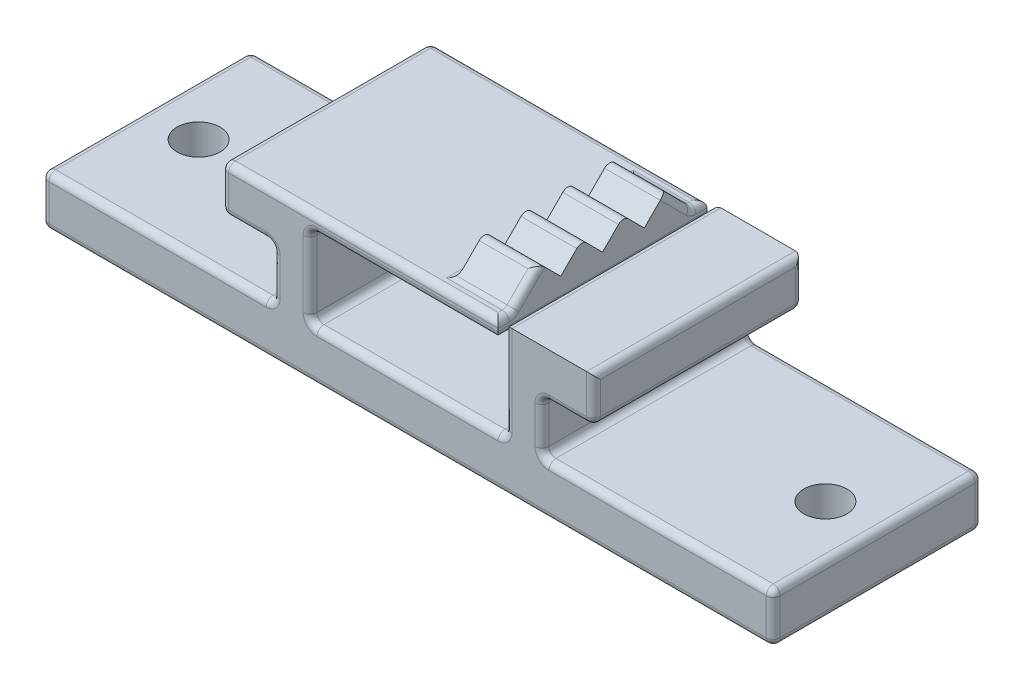
from build123d import *

# Parameters (mm, degrees)
BOSS_EXTRUDE1_DEPTH = 15
SKETCH4_W           = 14
SKETCH4_H           = 7
CUT_EXTRUDE1_DEPTH  = 121.267778243
SKETCH5_W           = 13.5
SKETCH5_H           = 15
BOSS_EXTRUDE2_DEPTH = 1.2
SKETCH6_W           = 3
SKETCH6_H           = 0.5
BOSS_EXTRUDE3_DEPTH = 4
LPATTERN1_COUNT     = 4
LPATTERN1_PITCH     = 3
BOSS_EXTRUDE4_DEPTH = 4
FILLET1_R           = 0.5
SKETCH8_R           = 1.55
CUT_EXTRUDE2_DEPTH  = 92.025163668


with BuildPart() as part:
    # Sketch2 → Boss-Extrude1 (new body)
    with BuildSketch(Plane.XY):
        Polygon((-72.321288744, 76.276019576), (-72.321288744, 72.576019576), (-62.671288744, 72.576019576), (-53.021288744, 72.576019576), (-53.021288744, 76.276019576), (-49.321288744, 76.276019576), (-49.321288744, 79.576019576), (-76.021288744, 79.576019576), (-76.021288744, 76.276019576), align=None)
        Polygon((-62.671288744, 72.576019576), (-62.671288744, 68.976019576), (-36.421288744, 68.976019576), (-36.421288744, 72.576019576), (-53.021288744, 72.576019576), align=None)
        Polygon((-72.321288744, 72.576019576), (-88.921288744, 72.576019576), (-88.921288744, 68.976019576), (-62.671288744, 68.976019576), (-62.671288744, 72.576019576), align=None)
    extrude(amount=BOSS_EXTRUDE1_DEPTH)

    # Sketch4 → Cut-Extrude1 (cut, through all)
    with BuildSketch(Plane(origin=(0, 0, 0), x_dir=(-1, 0, 0), z_dir=(0, 0, -1))):
        with Locations((62.671288744, 76.076019576)):
            Rectangle(SKETCH4_W, SKETCH4_H)
    extrude(amount=-CUT_EXTRUDE1_DEPTH, mode=Mode.SUBTRACT)

    # Sketch5 → Boss-Extrude2 (add)
    with BuildSketch(Plane(origin=(0, 79.576019576, 0), x_dir=(1, 0, 0), z_dir=(0, 1, 0))):
        with Locations((-62.921288744, -7.5)):
            Rectangle(SKETCH5_W, SKETCH5_H)
    extrude(amount=-BOSS_EXTRUDE2_DEPTH)

    # Sketch6 → Boss-Extrude3 (add)
    with BuildSketch(Plane(origin=(-56.171288744, 0, 0), x_dir=(0, 0, -1), z_dir=(1, 0, 0))):
        with Locations((-12, 79.826019576)):
            Rectangle(SKETCH6_W, SKETCH6_H)
        Polygon((-10.5, 80.076019576), (-13.5, 80.076019576), (-12, 81.576019576), align=None)
    boss_extrude3 = extrude(amount=-BOSS_EXTRUDE3_DEPTH)

    # LPattern1: Boss-Extrude3 ×4
    with Locations(*[(0, 0, -i * LPATTERN1_PITCH) for i in range(1, LPATTERN1_COUNT)]):
        add(boss_extrude3)

    # Sketch7 → Boss-Extrude4 (add)
    with BuildSketch(Plane(origin=(-56.171288744, 0, 0), x_dir=(0, 0, -1), z_dir=(1, 0, 0))):
        Polygon((-13.5, 80.076019576), (-13.5, 79.576019576), (-14, 79.576019576), align=None)
        Polygon((-1.5, 80.076019576), (-1.5, 79.576019576), (-1, 79.576019576), align=None)
    extrude(amount=-BOSS_EXTRUDE4_DEPTH)

    # Fillet1
    fillet1_edges = [part.edges().sort_by_distance(p)[0] for p in [
        (-72.321288744, 76.276019576, 7.5),
        (-72.321288744, 72.576019576, 7.5),
        (-72.321288744, 74.426019576, 0),
        (-72.321288744, 74.426019576, 15),
        (-74.171288744, 76.276019576, 15),
        (-80.621288744, 72.576019576, 15),
        (-88.921288744, 70.776019576, 15),
        (-62.671288744, 68.976019576, 15),
        (-36.421288744, 70.776019576, 15),
        (-44.721288744, 72.576019576, 15),
        (-53.021288744, 74.426019576, 15),
        (-51.171288744, 76.276019576, 15),
        (-49.321288744, 77.926019576, 15),
        (-55.671288744, 76.076019576, 15),
        (-62.671288744, 72.576019576, 15),
        (-69.671288744, 75.476019576, 15),
        (-62.921288744, 78.376019576, 15),
        (-66.096288744, 79.576019576, 15),
        (-76.021288744, 77.926019576, 15),
        (-76.021288744, 79.576019576, 7.5),
        (-76.021288744, 76.276019576, 7.5),
        (-76.021288744, 77.926019576, 0),
        (-66.096288744, 79.576019576, 0),
        (-56.171288744, 79.576019576, 0.5),
        (-58.171288744, 79.576019576, 1),
        (-60.171288744, 79.576019576, 7.5),
        (-58.171288744, 79.576019576, 14),
        (-56.171288744, 79.576019576, 14.5),
        (-58.171288744, 81.576019576, 12),
        (-56.171288744, 80.576019576, 13),
        (-58.171288744, 81.576019576, 9),
        (-58.171288744, 81.576019576, 6),
        (-58.171288744, 81.576019576, 3),
        (-56.171288744, 80.576019576, 2),
        (-56.171288744, 78.376019576, 7.5),
        (-62.921288744, 78.376019576, 0),
        (-69.671288744, 78.376019576, 7.5),
        (-69.671288744, 75.476019576, 0),
        (-69.671288744, 72.576019576, 7.5),
        (-62.671288744, 72.576019576, 0),
        (-55.671288744, 72.576019576, 7.5),
        (-55.671288744, 76.076019576, 0),
        (-55.671288744, 79.576019576, 7.5),
        (-49.321288744, 79.576019576, 7.5),
        (-49.321288744, 76.276019576, 7.5),
        (-49.321288744, 77.926019576, 0),
        (-53.021288744, 76.276019576, 7.5),
        (-51.171288744, 76.276019576, 0),
        (-53.021288744, 72.576019576, 7.5),
        (-53.021288744, 74.426019576, 0),
        (-44.721288744, 72.576019576, 0),
        (-36.421288744, 72.576019576, 7.5),
        (-36.421288744, 68.976019576, 7.5),
        (-36.421288744, 70.776019576, 0),
        (-62.671288744, 68.976019576, 0),
        (-88.921288744, 68.976019576, 7.5),
        (-88.921288744, 72.576019576, 7.5),
        (-88.921288744, 70.776019576, 0),
        (-74.171288744, 76.276019576, 0),
        (-80.621288744, 72.576019576, 0),
    ]]
    fillet(fillet1_edges, radius=FILLET1_R - 0.0001)  # a hair under: the kernel refuses the full size

    # Sketch8 → Cut-Extrude2 (cut, through all)
    with BuildSketch(Plane.XZ.offset(-68.976019576)):
        with Locations(Location((-85.171288744, 7.5, 0), (0, 0, 270))):
            Circle(SKETCH8_R)
        with Locations(Location((-40.171288744, 7.5, 0), (0, 0, 270))):
            Circle(SKETCH8_R)
    extrude(amount=-CUT_EXTRUDE2_DEPTH, mode=Mode.SUBTRACT)


solid = part.part
